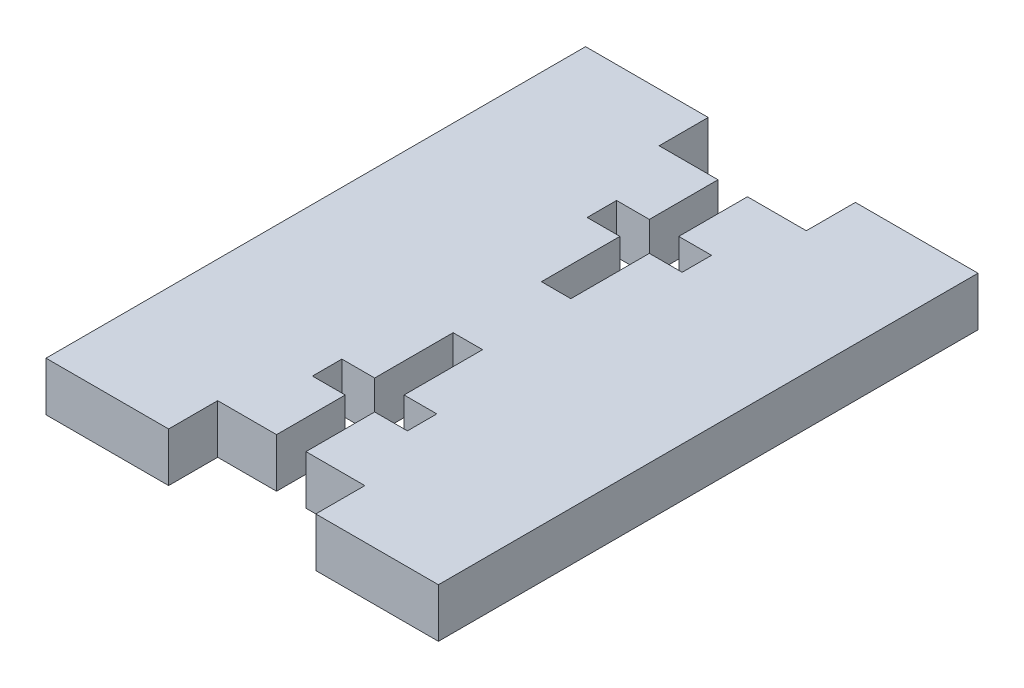
from build123d import *

# Parameters (mm, degrees)
SCHIZZO1_W                   = 40
SCHIZZO1_H                   = 55
ESTRUSIONE_ESTRUSIONE2_DEPTH = 5
SCHIZZO2_W                   = 15
SCHIZZO2_H                   = 5
TAGLIO_ESTRUSIONE1_DEPTH     = 62.661600097
TAGLIO_ESTRUSIONE3_DEPTH     = 62.661600097


with BuildPart() as part:
    # Schizzo1 → Estrusione-Estrusione2 (new body)
    with BuildSketch(Plane(origin=(0, 0, 0), x_dir=(1, 0, 0), z_dir=(0, 1, 0))):
        with Locations((-34.56494914, -0.781075862)):
            Rectangle(SCHIZZO1_W, SCHIZZO1_H)
    extrude(amount=-ESTRUSIONE_ESTRUSIONE2_DEPTH)

    # Schizzo2 → Taglio-Estrusione1 (cut, through all)
    with BuildSketch(Plane(origin=(0, 0, 0), x_dir=(1, 0, 0), z_dir=(0, 1, 0))):
        with Locations((-34.56494914, -25.781075862)):
            Rectangle(SCHIZZO2_W, SCHIZZO2_H)
        with Locations((-34.56494914, 24.218924138)):
            Rectangle(SCHIZZO2_W, SCHIZZO2_H)
    extrude(amount=-TAGLIO_ESTRUSIONE1_DEPTH, mode=Mode.SUBTRACT)

    # Schizzo3 → Taglio-Estrusione3 (cut, through all)
    with BuildSketch(Plane(origin=(0, 0, 0), x_dir=(1, 0, 0), z_dir=(0, 1, 0))):
        Polygon((-36.06494914, -23.281075862), (-33.06494914, -23.281075862), (-33.06494914, -16.281075862), (-29.72494914, -16.281075862), (-29.72494914, -13.281075862), (-33.06494914, -13.281075862), (-33.06494914, -5.281075862), (-36.06494914, -5.281075862), (-36.06494914, -13.281075862), (-39.40494914, -13.281075862), (-39.40494914, -16.281075862), (-36.06494914, -16.281075862), align=None)
        Polygon((-36.06494914, 3.718924138), (-33.06494914, 3.718924138), (-33.06494914, 11.718924138), (-29.72494914, 11.718924138), (-29.72494914, 14.718924138), (-33.06494914, 14.718924138), (-33.06494914, 21.718924138), (-36.06494914, 21.718924138), (-36.06494914, 14.718924138), (-39.40494914, 14.718924138), (-39.40494914, 11.718924138), (-36.06494914, 11.718924138), align=None)
    extrude(amount=-TAGLIO_ESTRUSIONE3_DEPTH, mode=Mode.SUBTRACT)


solid = part.part
